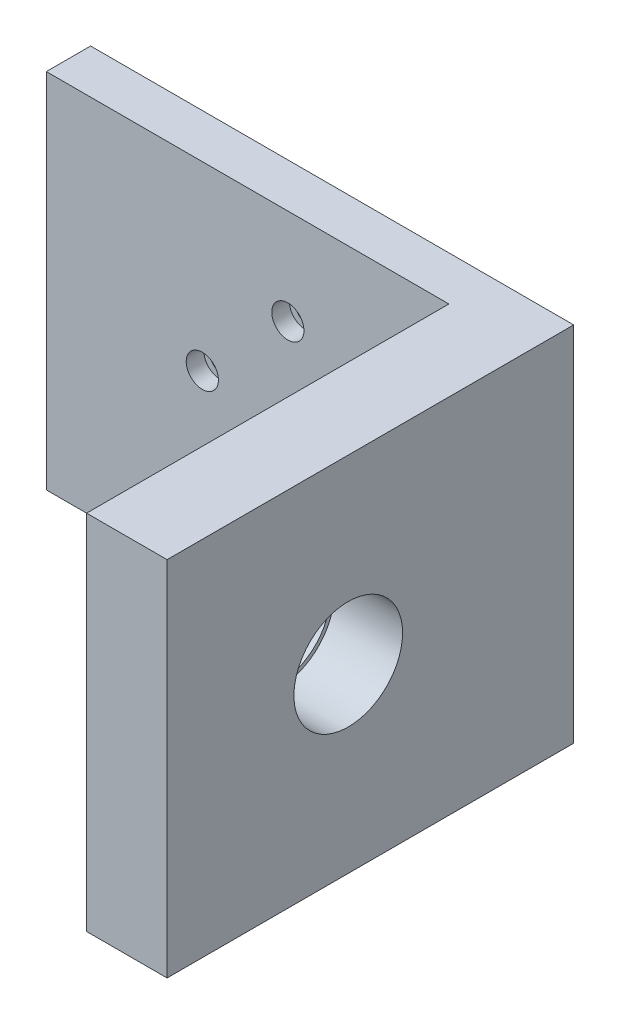
from build123d import *

# Parameters (mm, degrees)
SKETCH1_W                                           = 120
SKETCH1_H                                           = 90
SKETCH1_R                                           = 41.25
BOSS_EXTRUDE1_DEPTH                                 = 3
SKETCH2_W                                           = 120
SKETCH2_H                                           = 90
BOSS_EXTRUDE2_DEPTH                                 = 8
CBORE_FOR_M4_HEX_SOCKET_HEAD_CAP_SCREW1_D           = 4.8
CBORE_FOR_M4_HEX_SOCKET_HEAD_CAP_SCREW1_CBORE_D     = 8
CBORE_FOR_M4_HEX_SOCKET_HEAD_CAP_SCREW1_CBORE_DEPTH = 4.4
SKETCH5_W                                           = 20
SKETCH5_H                                           = 90
BOSS_EXTRUDE3_DEPTH                                 = 90
SKETCH6_R                                           = 13.5
CUT_EXTRUDE1_DEPTH                                  = 17
SKETCH7_R                                           = 12.5
CUT_EXTRUDE2_DEPTH                                  = 152.112540843


with BuildPart() as part:
    # Sketch1 → Boss-Extrude1 (new body)
    with BuildSketch(Plane.XY):
        Rectangle(SKETCH1_W, SKETCH1_H)
        Circle(SKETCH1_R, mode=Mode.SUBTRACT)
    extrude(amount=BOSS_EXTRUDE1_DEPTH)

    # Sketch2 → Boss-Extrude2 (add)
    with BuildSketch(Plane.XY.offset(3)):
        Rectangle(SKETCH2_W, SKETCH2_H)
    extrude(amount=BOSS_EXTRUDE2_DEPTH)

    # CBORE for M4 Hex Socket Head Cap Screw1 (through all)
    with Locations(Plane.XY.offset(11)):
        with Locations((-21.25, 0), (0, 21.25), (21.25, 0), (0, -21.25)):
            CounterBoreHole(CBORE_FOR_M4_HEX_SOCKET_HEAD_CAP_SCREW1_D / 2, CBORE_FOR_M4_HEX_SOCKET_HEAD_CAP_SCREW1_CBORE_D / 2, CBORE_FOR_M4_HEX_SOCKET_HEAD_CAP_SCREW1_CBORE_DEPTH)

    # Sketch5 → Boss-Extrude3 (add)
    with BuildSketch(Plane.XY.offset(11)):
        with Locations((50, 0)):
            Rectangle(SKETCH5_W, SKETCH5_H)
    extrude(amount=BOSS_EXTRUDE3_DEPTH)

    # Sketch6 → Cut-Extrude1 (cut)
    with BuildSketch(Plane(origin=(60, 0, 0), x_dir=(0, 0, -1), z_dir=(1, 0, 0))):
        with Locations((-56, 0)):
            Circle(SKETCH6_R)
    extrude(amount=-CUT_EXTRUDE1_DEPTH, mode=Mode.SUBTRACT)

    # Sketch7 → Cut-Extrude2 (cut, through all)
    with BuildSketch(Plane(origin=(43, 0, 0), x_dir=(0, 0, -1), z_dir=(1, 0, 0))):
        with Locations((-56, 0)):
            Circle(SKETCH7_R)
    extrude(amount=-CUT_EXTRUDE2_DEPTH, mode=Mode.SUBTRACT)


solid = part.part
